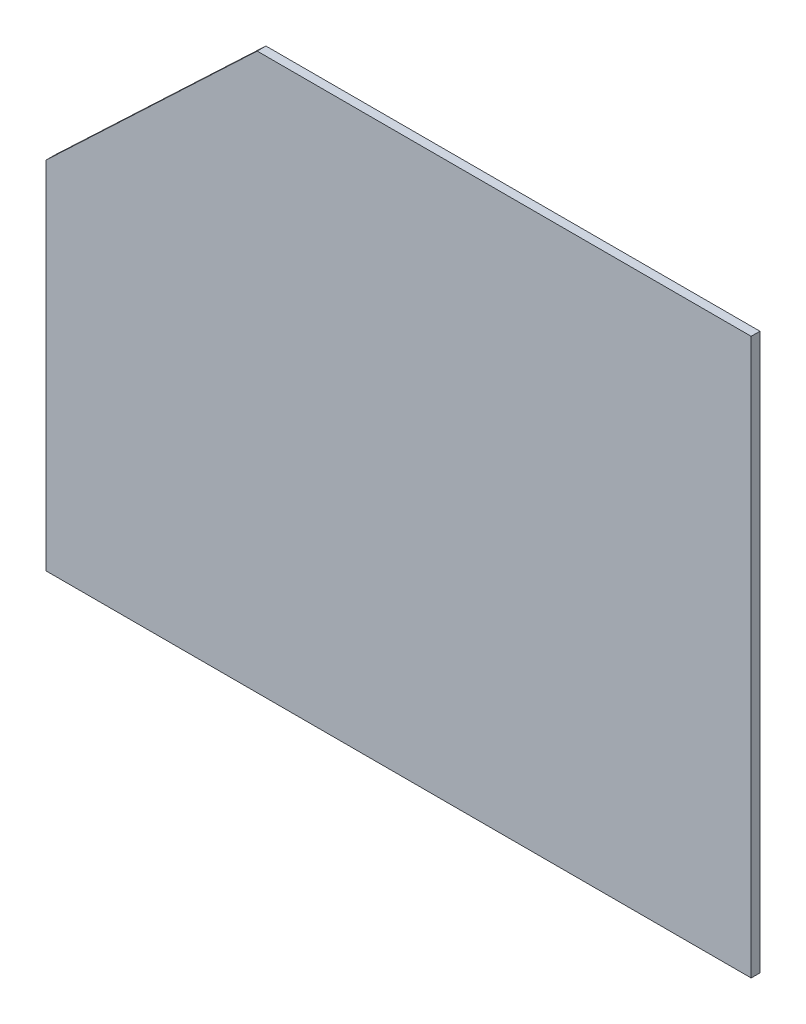
from build123d import *

# Parameters (mm, degrees)
SKETCH1_W           = 914.4
SKETCH1_H           = 609.6
BOSS_EXTRUDE1_DEPTH = 4.7625
CUT_EXTRUDE2_DEPTH  = 4.7625


with BuildPart() as part:
    # Sketch1 → Boss-Extrude1 (new body)
    with BuildSketch(Plane.XY):
        with Locations((457.2, 304.8)):
            Rectangle(SKETCH1_W, SKETCH1_H)
    extrude(amount=BOSS_EXTRUDE1_DEPTH)

    # Sketch4 → Cut-Extrude2 (cut)
    with BuildSketch(Plane.XY.offset(4.7625)):
        Polygon((914.4, 301.432583596), (914.4, 609.6), (0, 609.6), (0, 0), (531.956644177, 0), (531.956644177, 193.001775375), (646.448801926, 301.432583596), align=None)
    extrude(amount=-CUT_EXTRUDE2_DEPTH, mode=Mode.SUBTRACT)


solid = part.part
